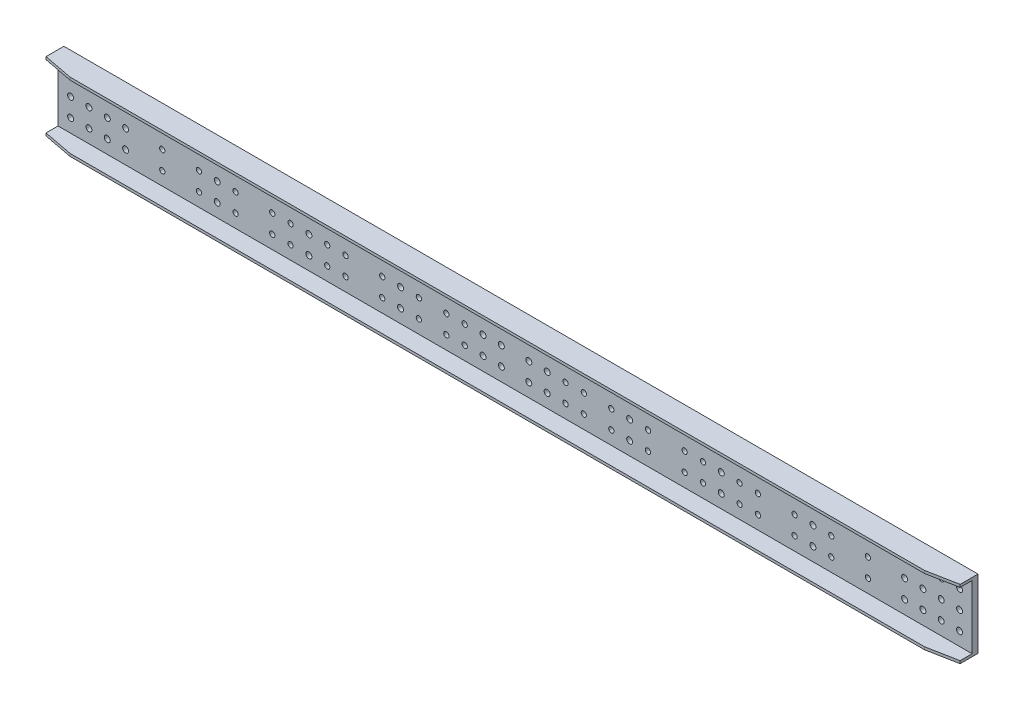
from build123d import *

# Parameters (mm, degrees)
SKETCH_1_W          = 3990
SKETCH_1_H          = 300
SKETCH_1_R          = 13
SKETCH_1_R_2        = 11.5
EXTRUDE_1540_DEPTH  = 25.5
SKETCH_2_W          = 3990
SKETCH_2_H          = 11.5
EXTRUDE_1_DEPTH     = 77.5
SKETCH_3_W          = 70
SKETCH_3_H          = 230
EXTRUDE_2_DEPTH     = 16
SKETCH_4_R          = 13
CUT_EXTRUDE_1_DEPTH = 2003.131676489
CUT_EXTRUDE_2_DEPTH = 2021.057919962


with BuildPart() as part:
    # 草图1 → Extrude 1540 (new body)
    with BuildSketch(Plane.XY):
        Rectangle(SKETCH_1_W, SKETCH_1_H)
        with Locations((1940, 80)):
            Circle(SKETCH_1_R, mode=Mode.SUBTRACT)
        with Locations((1860, 80)):
            Circle(SKETCH_1_R, mode=Mode.SUBTRACT)
        with Locations((1780, 80)):
            Circle(SKETCH_1_R, mode=Mode.SUBTRACT)
        with Locations((1700, 80)):
            Circle(SKETCH_1_R, mode=Mode.SUBTRACT)
        with Locations((1540, 80)):
            Circle(SKETCH_1_R_2, mode=Mode.SUBTRACT)
        with Locations((1380, 80)):
            Circle(SKETCH_1_R_2, mode=Mode.SUBTRACT)
        with Locations((1220, 80)):
            Circle(SKETCH_1_R_2, mode=Mode.SUBTRACT)
        with Locations((1060, 80)):
            Circle(SKETCH_1_R_2, mode=Mode.SUBTRACT)
        with Locations((980, 80)):
            Circle(SKETCH_1_R_2, mode=Mode.SUBTRACT)
        with Locations((820, 80)):
            Circle(SKETCH_1_R_2, mode=Mode.SUBTRACT)
        with Locations((740, 80)):
            Circle(SKETCH_1_R_2, mode=Mode.SUBTRACT)
        with Locations((580, 80)):
            Circle(SKETCH_1_R_2, mode=Mode.SUBTRACT)
        with Locations((980, 0)):
            Circle(SKETCH_1_R_2, mode=Mode.SUBTRACT)
        with Locations((1060, 0)):
            Circle(SKETCH_1_R_2, mode=Mode.SUBTRACT)
        with Locations((820, 0)):
            Circle(SKETCH_1_R_2, mode=Mode.SUBTRACT)
        with Locations((740, 0)):
            Circle(SKETCH_1_R_2, mode=Mode.SUBTRACT)
        with Locations((580, 0)):
            Circle(SKETCH_1_R_2, mode=Mode.SUBTRACT)
        with Locations((1220, 0)):
            Circle(SKETCH_1_R_2, mode=Mode.SUBTRACT)
        with Locations((1380, 0)):
            Circle(SKETCH_1_R_2, mode=Mode.SUBTRACT)
        with Locations((1540, 0)):
            Circle(SKETCH_1_R_2, mode=Mode.SUBTRACT)
        with Locations((1700, 0)):
            Circle(SKETCH_1_R, mode=Mode.SUBTRACT)
        with Locations((1780, 0)):
            Circle(SKETCH_1_R, mode=Mode.SUBTRACT)
        with Locations((1860, 0)):
            Circle(SKETCH_1_R, mode=Mode.SUBTRACT)
        with Locations((1940, 0)):
            Circle(SKETCH_1_R, mode=Mode.SUBTRACT)
        with Locations((420, 80)):
            Circle(SKETCH_1_R_2, mode=Mode.SUBTRACT)
        with Locations((420, 0)):
            Circle(SKETCH_1_R_2, mode=Mode.SUBTRACT)
        with Locations((300, 0)):
            Circle(SKETCH_1_R_2, mode=Mode.SUBTRACT)
        with Locations((300, 80)):
            Circle(SKETCH_1_R_2, mode=Mode.SUBTRACT)
        with Locations((220, 80)):
            Circle(SKETCH_1_R_2, mode=Mode.SUBTRACT)
        with Locations((220, 0)):
            Circle(SKETCH_1_R_2, mode=Mode.SUBTRACT)
        with Locations((140, 0)):
            Circle(SKETCH_1_R, mode=Mode.SUBTRACT)
        with Locations((140, 80)):
            Circle(SKETCH_1_R, mode=Mode.SUBTRACT)
        with Locations((60, 80)):
            Circle(SKETCH_1_R, mode=Mode.SUBTRACT)
        with Locations((60, 0)):
            Circle(SKETCH_1_R, mode=Mode.SUBTRACT)
        with Locations((1700, -80)):
            Circle(SKETCH_1_R, mode=Mode.SUBTRACT)
        with Locations((1780, -80)):
            Circle(SKETCH_1_R, mode=Mode.SUBTRACT)
        with Locations((1860, -80)):
            Circle(SKETCH_1_R, mode=Mode.SUBTRACT)
        with Locations((1940, -80)):
            Circle(SKETCH_1_R, mode=Mode.SUBTRACT)
        with Locations((580, -80)):
            Circle(SKETCH_1_R_2, mode=Mode.SUBTRACT)
        with Locations((740, -80)):
            Circle(SKETCH_1_R_2, mode=Mode.SUBTRACT)
        with Locations((820, -80)):
            Circle(SKETCH_1_R_2, mode=Mode.SUBTRACT)
        with Locations((980, -80)):
            Circle(SKETCH_1_R_2, mode=Mode.SUBTRACT)
        with Locations((1060, -80)):
            Circle(SKETCH_1_R_2, mode=Mode.SUBTRACT)
        with Locations((1220, -80)):
            Circle(SKETCH_1_R_2, mode=Mode.SUBTRACT)
        with Locations((1380, -80)):
            Circle(SKETCH_1_R_2, mode=Mode.SUBTRACT)
        with Locations((1540, -80)):
            Circle(SKETCH_1_R_2, mode=Mode.SUBTRACT)
        with Locations((220, -80)):
            Circle(SKETCH_1_R_2, mode=Mode.SUBTRACT)
        with Locations((300, -80)):
            Circle(SKETCH_1_R_2, mode=Mode.SUBTRACT)
        with Locations((420, -80)):
            Circle(SKETCH_1_R_2, mode=Mode.SUBTRACT)
        with Locations((60, -80)):
            Circle(SKETCH_1_R, mode=Mode.SUBTRACT)
        with Locations((140, -80)):
            Circle(SKETCH_1_R, mode=Mode.SUBTRACT)
        with Locations((-140, -80)):
            Circle(SKETCH_1_R, mode=Mode.SUBTRACT)
        with Locations((-60, -80)):
            Circle(SKETCH_1_R, mode=Mode.SUBTRACT)
        with Locations((-580, -80)):
            Circle(SKETCH_1_R_2, mode=Mode.SUBTRACT)
        with Locations((-420, -80)):
            Circle(SKETCH_1_R_2, mode=Mode.SUBTRACT)
        with Locations((-300, -80)):
            Circle(SKETCH_1_R_2, mode=Mode.SUBTRACT)
        with Locations((-220, -80)):
            Circle(SKETCH_1_R_2, mode=Mode.SUBTRACT)
        with Locations((-1540, -80)):
            Circle(SKETCH_1_R_2, mode=Mode.SUBTRACT)
        with Locations((-1380, -80)):
            Circle(SKETCH_1_R_2, mode=Mode.SUBTRACT)
        with Locations((-1220, -80)):
            Circle(SKETCH_1_R_2, mode=Mode.SUBTRACT)
        with Locations((-1060, -80)):
            Circle(SKETCH_1_R_2, mode=Mode.SUBTRACT)
        with Locations((-980, -80)):
            Circle(SKETCH_1_R_2, mode=Mode.SUBTRACT)
        with Locations((-820, -80)):
            Circle(SKETCH_1_R_2, mode=Mode.SUBTRACT)
        with Locations((-740, -80)):
            Circle(SKETCH_1_R_2, mode=Mode.SUBTRACT)
        with Locations((-1940, -80)):
            Circle(SKETCH_1_R, mode=Mode.SUBTRACT)
        with Locations((-1860, -80)):
            Circle(SKETCH_1_R, mode=Mode.SUBTRACT)
        with Locations((-1780, -80)):
            Circle(SKETCH_1_R, mode=Mode.SUBTRACT)
        with Locations((-1700, -80)):
            Circle(SKETCH_1_R, mode=Mode.SUBTRACT)
        with Locations((-60, 0)):
            Circle(SKETCH_1_R, mode=Mode.SUBTRACT)
        with Locations((-60, 80)):
            Circle(SKETCH_1_R, mode=Mode.SUBTRACT)
        with Locations((-140, 80)):
            Circle(SKETCH_1_R, mode=Mode.SUBTRACT)
        with Locations((-140, 0)):
            Circle(SKETCH_1_R, mode=Mode.SUBTRACT)
        with Locations((-220, 0)):
            Circle(SKETCH_1_R_2, mode=Mode.SUBTRACT)
        with Locations((-220, 80)):
            Circle(SKETCH_1_R_2, mode=Mode.SUBTRACT)
        with Locations((-300, 80)):
            Circle(SKETCH_1_R_2, mode=Mode.SUBTRACT)
        with Locations((-300, 0)):
            Circle(SKETCH_1_R_2, mode=Mode.SUBTRACT)
        with Locations((-420, 0)):
            Circle(SKETCH_1_R_2, mode=Mode.SUBTRACT)
        with Locations((-420, 80)):
            Circle(SKETCH_1_R_2, mode=Mode.SUBTRACT)
        with Locations((-1940, 0)):
            Circle(SKETCH_1_R, mode=Mode.SUBTRACT)
        with Locations((-1860, 0)):
            Circle(SKETCH_1_R, mode=Mode.SUBTRACT)
        with Locations((-1780, 0)):
            Circle(SKETCH_1_R, mode=Mode.SUBTRACT)
        with Locations((-1700, 0)):
            Circle(SKETCH_1_R, mode=Mode.SUBTRACT)
        with Locations((-1540, 0)):
            Circle(SKETCH_1_R_2, mode=Mode.SUBTRACT)
        with Locations((-1380, 0)):
            Circle(SKETCH_1_R_2, mode=Mode.SUBTRACT)
        with Locations((-1220, 0)):
            Circle(SKETCH_1_R_2, mode=Mode.SUBTRACT)
        with Locations((-580, 0)):
            Circle(SKETCH_1_R_2, mode=Mode.SUBTRACT)
        with Locations((-740, 0)):
            Circle(SKETCH_1_R_2, mode=Mode.SUBTRACT)
        with Locations((-820, 0)):
            Circle(SKETCH_1_R_2, mode=Mode.SUBTRACT)
        with Locations((-1060, 0)):
            Circle(SKETCH_1_R_2, mode=Mode.SUBTRACT)
        with Locations((-980, 0)):
            Circle(SKETCH_1_R_2, mode=Mode.SUBTRACT)
        with Locations((-580, 80)):
            Circle(SKETCH_1_R_2, mode=Mode.SUBTRACT)
        with Locations((-740, 80)):
            Circle(SKETCH_1_R_2, mode=Mode.SUBTRACT)
        with Locations((-820, 80)):
            Circle(SKETCH_1_R_2, mode=Mode.SUBTRACT)
        with Locations((-980, 80)):
            Circle(SKETCH_1_R_2, mode=Mode.SUBTRACT)
        with Locations((-1060, 80)):
            Circle(SKETCH_1_R_2, mode=Mode.SUBTRACT)
        with Locations((-1220, 80)):
            Circle(SKETCH_1_R_2, mode=Mode.SUBTRACT)
        with Locations((-1380, 80)):
            Circle(SKETCH_1_R_2, mode=Mode.SUBTRACT)
        with Locations((-1540, 80)):
            Circle(SKETCH_1_R_2, mode=Mode.SUBTRACT)
        with Locations((-1700, 80)):
            Circle(SKETCH_1_R, mode=Mode.SUBTRACT)
        with Locations((-1780, 80)):
            Circle(SKETCH_1_R, mode=Mode.SUBTRACT)
        with Locations((-1860, 80)):
            Circle(SKETCH_1_R, mode=Mode.SUBTRACT)
        with Locations((-1940, 80)):
            Circle(SKETCH_1_R, mode=Mode.SUBTRACT)
    extrude(amount=EXTRUDE_1540_DEPTH)

    # 草图2 → 凸台-拉伸1 (add)
    with BuildSketch(Plane.XY.offset(25.5)):
        with Locations((0, 144.25)):
            Rectangle(SKETCH_2_W, SKETCH_2_H)
        with Locations((0, -144.25)):
            Rectangle(SKETCH_2_W, SKETCH_2_H)
    extrude(amount=EXTRUDE_1_DEPTH)

    # 草图3 → 凸台-拉伸2 (add)
    with BuildSketch(Plane(origin=(0, 0, 0), x_dir=(-1, 0, 0), z_dir=(0, 0, -1))):
        with Locations((1300, 0)):
            Rectangle(SKETCH_3_W, SKETCH_3_H)
        with Locations((900, 0)):
            Rectangle(SKETCH_3_W, SKETCH_3_H)
        with Locations((-1300, 0)):
            Rectangle(SKETCH_3_W, SKETCH_3_H)
        with Locations((500, 0)):
            Rectangle(SKETCH_3_W, SKETCH_3_H)
        with Locations((-900, 0)):
            Rectangle(SKETCH_3_W, SKETCH_3_H)
        with Locations((-500, 0)):
            Rectangle(SKETCH_3_W, SKETCH_3_H)
    extrude(amount=EXTRUDE_2_DEPTH)

    # 草图4 → 切除-拉伸1 (cut, through all)
    with BuildSketch(Plane.XY.offset(25.5)):
        with Locations((1300, 80)):
            Circle(SKETCH_4_R)
        with Locations((900, 80)):
            Circle(SKETCH_4_R)
        with Locations((900, 0)):
            Circle(SKETCH_4_R)
        with Locations((1300, 0)):
            Circle(SKETCH_4_R)
        with Locations((900, -80)):
            Circle(SKETCH_4_R)
        with Locations((1300, -80)):
            Circle(SKETCH_4_R)
        with Locations((500, 80)):
            Circle(SKETCH_4_R)
        with Locations((500, 0)):
            Circle(SKETCH_4_R)
        with Locations((500, -80)):
            Circle(SKETCH_4_R)
        with Locations((-500, -80)):
            Circle(SKETCH_4_R)
        with Locations((-500, 0)):
            Circle(SKETCH_4_R)
        with Locations((-500, 80)):
            Circle(SKETCH_4_R)
        with Locations((-1300, -80)):
            Circle(SKETCH_4_R)
        with Locations((-900, -80)):
            Circle(SKETCH_4_R)
        with Locations((-1300, 0)):
            Circle(SKETCH_4_R)
        with Locations((-900, 0)):
            Circle(SKETCH_4_R)
        with Locations((-900, 80)):
            Circle(SKETCH_4_R)
        with Locations((-1300, 80)):
            Circle(SKETCH_4_R)
    extrude(amount=-CUT_EXTRUDE_1_DEPTH, mode=Mode.SUBTRACT)

    # 草图5 → 切除-拉伸2 (cut, through all)
    with BuildSketch(Plane(origin=(0, 150, 0), x_dir=(-1, 0, 0), z_dir=(0, 1, 0))):
        Polygon((-1995, 78), (-1995, 103), (-1865, 103), align=None)
        Polygon((1865, 103), (1995, 78), (1995, 103), align=None)
    extrude(amount=-CUT_EXTRUDE_2_DEPTH, mode=Mode.SUBTRACT)


solid = part.part
